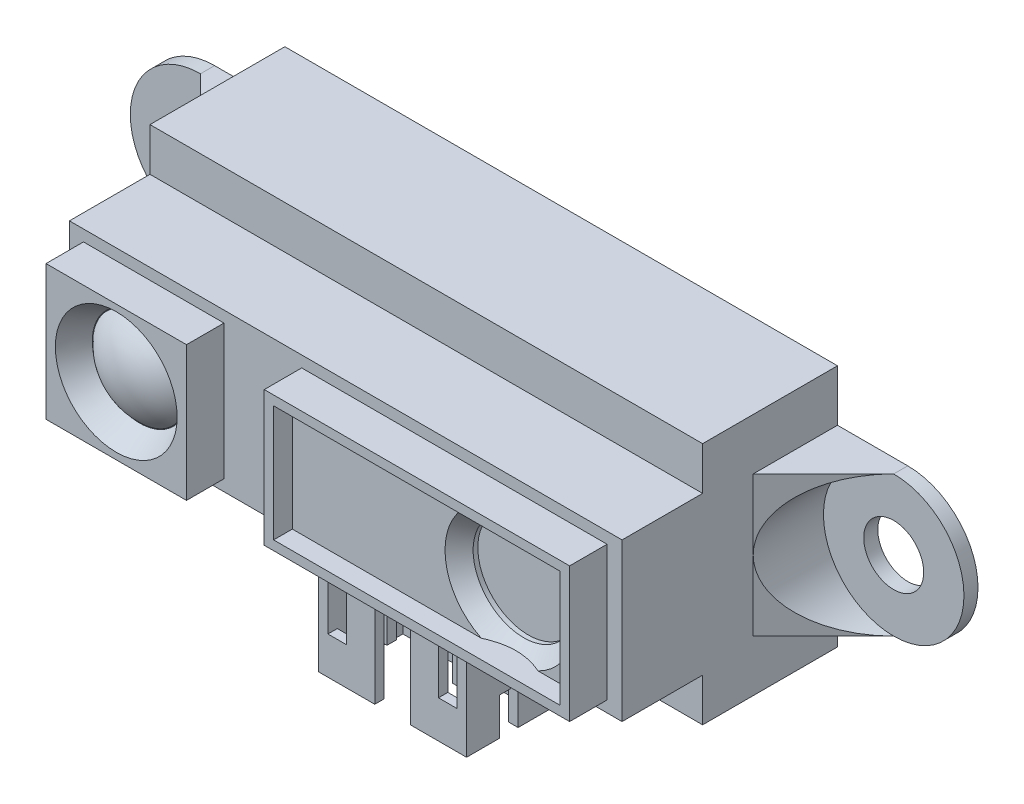
from build123d import *

# Parameters (mm, degrees)
BOSS_EXTRUDE5_DEPTH  = 14.75
SKETCH9_W            = 7.5
SKETCH9_H            = 7.2
SKETCH9_W_2          = 16.3
BOSS_EXTRUDE6_DEPTH  = 2
SKETCH10_W           = 15.3
SKETCH10_H           = 6.2
CUT_EXTRUDE4_DEPTH   = 1
SKETCH11_R           = 2.5
CUT_EXTRUDE5_DEPTH   = 1.25
BOSS_EXTRUDE7_DEPTH  = 4.5
CUT_EXTRUDE7_START   = -7.5
CUT_EXTRUDE7_DEPTH   = 7.5
SKETCH18_R           = 3.75
CUT_EXTRUDE8_DEPTH   = 4.5
SKETCH19_R           = 1.6
CUT_EXTRUDE9_DEPTH   = 4.5
CHAMFER1_SIZE        = 0.75
CHAMFER1_SIZE_2      = 1.299038106
SKETCH13_R           = 2.7
CUT_EXTRUDE6_DEPTH   = 1
CHAMFER2_SIZE        = 0.75
SKETCH20_W           = 10.01
SKETCH20_H           = 1.2
BOSS_EXTRUDE8_DEPTH  = 5.9
SKETCH21_W           = 7.9
SKETCH21_H           = 4.5
BOSS_EXTRUDE9_DEPTH  = 6
SKETCH23_W           = 6.9
SKETCH23_H           = 3.5
CUT_EXTRUDE11_DEPTH  = 5.5
SKETCH24_W           = 1.9
SKETCH24_H           = 5.5
SKETCH24_W_2         = 1
SKETCH24_H_2         = 4
CUT_EXTRUDE12_DEPTH  = 0.5
CUT_EXTRUDE13_REACH  = 34.015
SKETCH25_W           = 1
SKETCH25_H           = 2
SKETCH26_W           = 0.5
SKETCH26_H           = 0.5
BOSS_EXTRUDE10_DEPTH = 4
CHAMFER3_SIZE        = 0.1
LPATTERN1_COUNT      = 3
LPATTERN1_PITCH      = 2


# Read off the part's stored shape, not the designer's step: Cut-Extrude7
with BuildPart() as part:
    # Sketch8 → Boss-Extrude5 (new, symmetric)
    with BuildSketch(Plane(origin=(0, 0, 0), x_dir=(0, 0, -1), z_dir=(1, 0, 0))):
        Polygon((0, -6.5), (0, 6.5), (-7.2, 6.5), (-7.2, 4.2), (-11.5, 4.2), (-11.5, -4.2), (-7.2, -4.2), (-7.2, -6.5), align=None)
    extrude(amount=BOSS_EXTRUDE5_DEPTH, both=True)

    # Sketch9 → Boss-Extrude6 (add)
    with BuildSketch(Plane.XY.offset(11.5)):
        with Locations((-10.25, 0)):
            Rectangle(SKETCH9_W, SKETCH9_H)
        with Locations((5.8, 0)):
            Rectangle(SKETCH9_W_2, SKETCH9_H)
    extrude(amount=BOSS_EXTRUDE6_DEPTH)

    # Sketch10 → Cut-Extrude4 (cut)
    with BuildSketch(Plane.XY.offset(13.5)):
        with Locations((5.8, 0)):
            Rectangle(SKETCH10_W, SKETCH10_H)
    extrude(amount=-CUT_EXTRUDE4_DEPTH, mode=Mode.SUBTRACT)

    # Sketch11 → Cut-Extrude5 (cut)
    with BuildSketch(Plane.XY.offset(13.5)):
        with Locations((-10.25, 0)):
            Circle(SKETCH11_R)
    extrude(amount=-CUT_EXTRUDE5_DEPTH, mode=Mode.SUBTRACT)

    # Sketch16 → Boss-Extrude7 (add)
    with BuildSketch(Plane(origin=(0, 0, 0), x_dir=(-1, 0, 0), z_dir=(0, 0, -1))):
        with BuildLine():
            Line((-14.75, -3.75), (-14.75, 3.75))
            Line((-14.75, 3.75), (-18.5, 3.75))
            ThreePointArc((-18.5, 3.75), (-22.25, 0), (-18.5, -3.75))
            Line((-18.5, -3.75), (-14.75, -3.75))
        make_face()
    boss_extrude7 = extrude(amount=-BOSS_EXTRUDE7_DEPTH)

    # Cut-Extrude7 outline → Cut-Extrude7 (cut)
    with BuildSketch(Plane.XZ.offset(3.75).offset(CUT_EXTRUDE7_START)):
        Polygon((14.75, 4.5), (18.5, 0.75), (24, 0.75), (24, 4.5), align=None)
    cut_extrude7 = extrude(amount=CUT_EXTRUDE7_DEPTH, mode=Mode.SUBTRACT)

    # Sketch18 → Cut-Extrude8 (cut)
    with BuildSketch(Plane.XY.offset(0.75)):
        with Locations((18.5, 0)):
            Circle(SKETCH18_R)
    cut_extrude8 = extrude(amount=CUT_EXTRUDE8_DEPTH, mode=Mode.SUBTRACT)

    # Sketch19 → Cut-Extrude9 (cut)
    with BuildSketch(Plane.XY.offset(0.75)):
        with Locations((18.5, 0)):
            Circle(SKETCH19_R)
    cut_extrude9 = extrude(amount=-CUT_EXTRUDE9_DEPTH, mode=Mode.SUBTRACT)

    # Mirror1: Boss-Extrude7, Cut-Extrude7, Cut-Extrude8, Cut-Extrude9 across plane
    add(boss_extrude7.mirror(Plane(origin=(0, 0, 0), x_dir=(0, 0, 1), z_dir=(1, 0, 0))))
    add(cut_extrude7.mirror(Plane(origin=(0, 0, 0), x_dir=(0, 0, 1), z_dir=(1, 0, 0))), mode=Mode.SUBTRACT)
    add(cut_extrude8.mirror(Plane(origin=(0, 0, 0), x_dir=(0, 0, 1), z_dir=(1, 0, 0))), mode=Mode.SUBTRACT)
    add(cut_extrude9.mirror(Plane(origin=(0, 0, 0), x_dir=(0, 0, 1), z_dir=(1, 0, 0))), mode=Mode.SUBTRACT)

    # Chamfer1
    # the kernel refuses this chamfer: 1.299038106, 0.75 mm, written as the material it takes off along each edge
    with BuildSketch(Plane(origin=(-10.25, 0, 13.5), x_dir=(1, 0, 0), z_dir=(0, -1, 0))) as chamfer1_piece_1_section:
        Polygon((2.5 + CHAMFER1_SIZE, 0), (2.5, -CHAMFER1_SIZE_2), (2.5, 0), align=None)
    chamfer1_piece_1 = revolve(axis=Axis((-10.25, 0, 13.5), (0, 0, 1)), mode=Mode.PRIVATE)
    chamfer1_piece_1 = split(chamfer1_piece_1, bisect_by=Plane(origin=(-13.133837987, 0, 12.25), z_dir=(0, 0, 1)), keep=Keep.TOP, mode=Mode.PRIVATE)
    add(chamfer1_piece_1, mode=Mode.SUBTRACT)

    # Sketch13 → Cut-Extrude6 (cut)
    with BuildSketch(Plane.XY.offset(12.5)):
        with Locations((9.75, 0)):
            Circle(SKETCH13_R)
    extrude(amount=-CUT_EXTRUDE6_DEPTH, mode=Mode.SUBTRACT)

    # Chamfer2
    # the kernel refuses this chamfer: 0.75 mm, written as the material it takes off along each edge
    with BuildSketch(Plane(origin=(9.75, 0, 12.5), x_dir=(1, 0, 0), z_dir=(0, -1, 0))) as chamfer2_piece_1_section:
        Polygon((2.7 + CHAMFER2_SIZE, 0), (2.7, -CHAMFER2_SIZE), (2.7, 0), align=None)
    chamfer2_piece_1 = revolve(axis=Axis((9.75, 0, 12.5), (0, 0, 1)), mode=Mode.PRIVATE)
    chamfer2_piece_1 = split(chamfer2_piece_1, bisect_by=Plane(origin=(6.68747717, -3.1, 12.13747717), z_dir=(0, 1, 0)), keep=Keep.TOP, mode=Mode.PRIVATE)
    chamfer2_piece_1 = split(chamfer2_piece_1, bisect_by=Plane(origin=(6.68747717, 3.1, 12.13747717), z_dir=(0, -1, 0)), keep=Keep.TOP, mode=Mode.PRIVATE)
    add(chamfer2_piece_1, mode=Mode.SUBTRACT)


with BuildPart() as body_2:
    # Sketch12 → Revolve1 (revolve)
    with BuildSketch(Plane.ZY.offset(10.25), mode=Mode.PRIVATE) as revolve1_sk:
        with BuildLine():
            Line((12.25, 2.5), (12.25, 0))
            Line((12.25, 0), (13.351165831, 0))
            ThreePointArc((13.351165831, 0), (13.063678836, 1.365884895), (12.25, 2.5))
        make_face()
    revolve(revolve1_sk.sketch.rotate(Axis((-10.25, 0, 12.25), (0, 0, 1)), 180), axis=Axis((-10.25, 0, 12.25), (0, 0, 1)))


with BuildPart() as body_3:
    # Sketch20 → Boss-Extrude8 (new body)
    with BuildSketch(Plane.XZ.offset(6.5)):
        with Locations((0, 3.9)):
            Rectangle(SKETCH20_W, SKETCH20_H)
    extrude(amount=BOSS_EXTRUDE8_DEPTH)


with BuildPart() as body_4:
    # Sketch21 → Boss-Extrude9 (new body)
    with BuildSketch(Plane.XZ.offset(6.5)):
        with Locations((0, 6.75)):
            Rectangle(SKETCH21_W, SKETCH21_H)
    extrude(amount=BOSS_EXTRUDE9_DEPTH)

    # Sketch23 → Cut-Extrude11 (cut)
    with BuildSketch(Plane.XZ.offset(12.5)):
        with Locations((0, 6.75)):
            Rectangle(SKETCH23_W, SKETCH23_H)
    extrude(amount=-CUT_EXTRUDE11_DEPTH, mode=Mode.SUBTRACT)

    # Sketch24 → Cut-Extrude12 (cut)
    with BuildSketch(Plane.XY.offset(9)):
        with Locations((0, -9.75)):
            Rectangle(SKETCH24_W, SKETCH24_H)
        with Locations((-2.95, -8.5)):
            Rectangle(SKETCH24_W_2, SKETCH24_H_2)
        with Locations((2.95, -8.5)):
            Rectangle(SKETCH24_W_2, SKETCH24_H_2)
    extrude(amount=-CUT_EXTRUDE12_DEPTH, mode=Mode.SUBTRACT)

    # Cut-Extrude13: up to this face of the body (flat: up to its plane)
    cut_extrude13_end = Plane(body_4.part.faces().sort_by_distance((3.95, -9.5, 6.75))[0])
    # Sketch25 → Cut-Extrude13 (cut, up to the picked face)
    with BuildSketch(Plane.ZY.offset(3.95), mode=Mode.PRIVATE) as cut_extrude13_sk1:
        with Locations((6.75, -11.5)):
            Rectangle(SKETCH25_W, SKETCH25_H)
    cut_extrude13_tool1 = split(extrude(cut_extrude13_sk1.sketch, amount=-CUT_EXTRUDE13_REACH, mode=Mode.PRIVATE), bisect_by=cut_extrude13_end, keep=Keep.BOTH, mode=Mode.PRIVATE)
    add(cut_extrude13_tool1.solids().sort_by(Axis((-3.95, -11.5, 6.75), (1, 0, 0)))[0], mode=Mode.SUBTRACT)


with BuildPart() as body_5:
    # Sketch26 → Boss-Extrude10 (new body)
    with BuildSketch(Plane.XZ.offset(7)):
        with Locations((-2, 7.3)):
            Rectangle(SKETCH26_W, SKETCH26_H)
    extrude(amount=BOSS_EXTRUDE10_DEPTH)

    # Chamfer3
    chamfer3_edges = [body_5.edges().sort_by_distance(p)[0] for p in [
        (-2.25, -11, 7.3),
        (-2, -11, 7.05),
        (-1.75, -11, 7.3),
        (-2, -11, 7.55),
    ]]
    chamfer(chamfer3_edges, length=CHAMFER3_SIZE)


with BuildPart() as lpattern1_1:
    # LPattern1: pattern copy
    add(body_5.part.moved(Location(Vector(1, 0, 0) * (1 * LPATTERN1_PITCH))))


with BuildPart() as lpattern1_2:
    # LPattern1: pattern copy
    add(body_5.part.moved(Location(Vector(1, 0, 0) * (2 * LPATTERN1_PITCH))))


solid = Compound([part.part, body_2.part, body_3.part, body_4.part, body_5.part, lpattern1_1.part, lpattern1_2.part])
